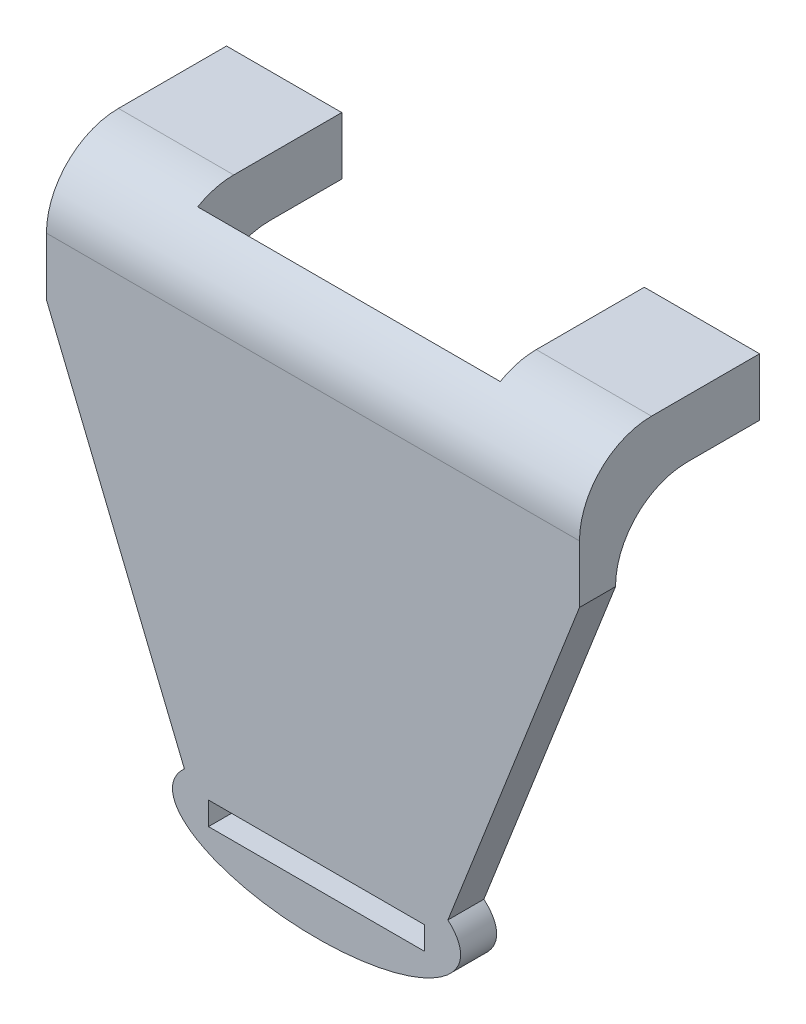
from build123d import *

# Parameters (mm, degrees)
PLATE_FEATURE_DEPTH        = 5
STRAP_FEATURE_SKETCH_RX    = 20
STRAP_FEATURE_SKETCH_RY    = 8
STRAP_FEATURE_DEPTH        = 5
STRAP_CUT_SKETCH_W         = 30
STRAP_CUT_SKETCH_H         = 3.19824666
STRAP_CUT_DEPTH            = 5
LEFT_LEG_FEATURE_SKETCH_W  = 16
LEFT_LEG_FEATURE_SKETCH_H  = 8
LEFT_LEG_FEATURE_DEPTH     = 20
RIGHT_LEG_FEATURE_SKETCH_W = 16
RIGHT_LEG_FEATURE_SKETCH_H = 8
RIGHT_LEG_FEATURE_DEPTH    = 20
TAB_CUT_SKETCH_W           = 8
TAB_CUT_SKETCH_H           = 15
TAB_CUT_DEPTH              = 5
FILLET1_R                  = 10
FILLET2_R                  = 10
FILLET3_R                  = 10


with BuildPart() as part:
    # Plate Feature Sketch → Plate Feature (new body)
    with BuildSketch(Plane.XY):
        Polygon((-36, 18), (-36, 0), (-15.55368079, -50), (18.44631921, -50), (38, 0), (38, 18), align=None)
    extrude(amount=PLATE_FEATURE_DEPTH)

    # Strap Feature Sketch → Strap Feature (add)
    with BuildSketch(Plane.XY):
        with Locations((1.5, -50)):
            Ellipse(STRAP_FEATURE_SKETCH_RX, STRAP_FEATURE_SKETCH_RY)
    extrude(amount=STRAP_FEATURE_DEPTH)

    # Strap Cut Sketch → Strap Cut (cut)
    with BuildSketch(Plane.XY):
        with Locations((1.5, -50.5)):
            Rectangle(STRAP_CUT_SKETCH_W, STRAP_CUT_SKETCH_H)
    extrude(amount=STRAP_CUT_DEPTH, mode=Mode.SUBTRACT)

    # Left Leg Feature Sketch → Left Leg Feature (add)
    with BuildSketch(Plane.XY):
        with Locations((30, 14)):
            Rectangle(LEFT_LEG_FEATURE_SKETCH_W, LEFT_LEG_FEATURE_SKETCH_H)
    extrude(amount=-LEFT_LEG_FEATURE_DEPTH)

    # Right Leg Feature Sketch → Right Leg Feature (add)
    with BuildSketch(Plane.XY):
        with Locations((-28, 14)):
            Rectangle(RIGHT_LEG_FEATURE_SKETCH_W, RIGHT_LEG_FEATURE_SKETCH_H)
    extrude(amount=-RIGHT_LEG_FEATURE_DEPTH)

    # Tab Cut Sketch → Tab Cut (cut)
    with BuildSketch(Plane(origin=(0, 10, 0), x_dir=(1, 0, 0), z_dir=(0, 1, 0))):
        with Locations((-28, 12.5)):
            Rectangle(TAB_CUT_SKETCH_W, TAB_CUT_SKETCH_H)
        with Locations((30, 12.5)):
            Rectangle(TAB_CUT_SKETCH_W, TAB_CUT_SKETCH_H)
    extrude(amount=TAB_CUT_DEPTH, mode=Mode.SUBTRACT)

    # Fillet1
    # the kernel refuses this fillet: 10 mm, written as the material it takes off along each edge
    with BuildSketch(Plane(origin=(63, 18, 5), x_dir=(0, 0, -1), z_dir=(-1, 0, 0))) as fillet1_piece_1:
        with BuildLine():
            CenterArc((FILLET1_R, FILLET1_R), FILLET1_R, 180, 90)
            Line((0, FILLET1_R), (0, 0))
            Line((0, 0), (FILLET1_R, 0))
        make_face()
    extrude(amount=124, mode=Mode.SUBTRACT)

    # Fillet2
    # the kernel refuses this fillet: 10 mm, written as the material it adds along each edge
    with BuildSketch(Plane(origin=(-36, 10, 0), x_dir=(0, 0, -1), z_dir=(1, 0, 0))) as fillet2_piece_1_section:
        with BuildLine():
            CenterArc((FILLET2_R, -FILLET2_R), FILLET2_R, 90, 90)
            Line((0, -FILLET2_R), (0, 0))
            Line((0, 0), (FILLET2_R, 0))
        make_face()
    fillet2_piece_1 = extrude(amount=16, mode=Mode.PRIVATE)
    fillet2_piece_1 = split(fillet2_piece_1, bisect_by=Plane(origin=(-34, 9.759916183, -5), z_dir=(0, 0, -1)), keep=Keep.TOP, mode=Mode.PRIVATE)
    fillet2_piece_1 = split(fillet2_piece_1, bisect_by=Plane(origin=(-32, 9.759916183, -6.632507845), z_dir=(-1, 0, 0)), keep=Keep.TOP, mode=Mode.PRIVATE)
    add(fillet2_piece_1)
    with BuildSketch(Plane(origin=(-36, 10, 0), x_dir=(0, 0, -1), z_dir=(1, 0, 0))) as fillet2_piece_2_section:
        with BuildLine():
            CenterArc((FILLET2_R, -FILLET2_R), FILLET2_R, 90, 90)
            Line((0, -FILLET2_R), (0, 0))
            Line((0, 0), (FILLET2_R, 0))
        make_face()
    fillet2_piece_2 = extrude(amount=16, mode=Mode.PRIVATE)
    fillet2_piece_2 = split(fillet2_piece_2, bisect_by=Plane(origin=(-34, 7.4487994, -5), z_dir=(0, 0, 1)), keep=Keep.TOP, mode=Mode.PRIVATE)
    fillet2_piece_2 = split(fillet2_piece_2, bisect_by=Plane(origin=(-32, 7.4487994, -1.643917643), z_dir=(-1, 0, 0)), keep=Keep.TOP, mode=Mode.PRIVATE)
    add(fillet2_piece_2)
    with BuildSketch(Plane(origin=(-36, 10, 0), x_dir=(0, 0, -1), z_dir=(1, 0, 0))) as fillet2_piece_3_section:
        with BuildLine():
            CenterArc((FILLET2_R, -FILLET2_R), FILLET2_R, 90, 90)
            Line((0, -FILLET2_R), (0, 0))
            Line((0, 0), (FILLET2_R, 0))
        make_face()
    fillet2_piece_3 = extrude(amount=16, mode=Mode.PRIVATE)
    fillet2_piece_3 = split(fillet2_piece_3, bisect_by=Plane(origin=(-24, 7.4487994, -1.643917643), z_dir=(-1, 0, 0)), keep=Keep.TOP, mode=Mode.PRIVATE)
    fillet2_piece_3 = split(fillet2_piece_3, bisect_by=Plane(origin=(-28, 7.4487994, -5), z_dir=(0, 0, 1)), keep=Keep.TOP, mode=Mode.PRIVATE)
    fillet2_piece_3 = split(fillet2_piece_3, bisect_by=Plane(origin=(-32, 7.4487994, -1.643917643), z_dir=(1, 0, 0)), keep=Keep.TOP, mode=Mode.PRIVATE)
    add(fillet2_piece_3)
    with BuildSketch(Plane(origin=(-36, 10, 0), x_dir=(0, 0, -1), z_dir=(1, 0, 0))) as fillet2_piece_4_section:
        with BuildLine():
            CenterArc((FILLET2_R, -FILLET2_R), FILLET2_R, 90, 90)
            Line((0, -FILLET2_R), (0, 0))
            Line((0, 0), (FILLET2_R, 0))
        make_face()
    fillet2_piece_4 = extrude(amount=16, mode=Mode.PRIVATE)
    fillet2_piece_4 = split(fillet2_piece_4, bisect_by=Plane(origin=(-24, 9.759916183, -6.632507845), z_dir=(1, 0, 0)), keep=Keep.TOP, mode=Mode.PRIVATE)
    fillet2_piece_4 = split(fillet2_piece_4, bisect_by=Plane(origin=(-22, 9.759916183, -5), z_dir=(0, 0, -1)), keep=Keep.TOP, mode=Mode.PRIVATE)
    add(fillet2_piece_4)
    with BuildSketch(Plane(origin=(-36, 10, 0), x_dir=(0, 0, -1), z_dir=(1, 0, 0))) as fillet2_piece_5_section:
        with BuildLine():
            CenterArc((FILLET2_R, -FILLET2_R), FILLET2_R, 90, 90)
            Line((0, -FILLET2_R), (0, 0))
            Line((0, 0), (FILLET2_R, 0))
        make_face()
    fillet2_piece_5 = extrude(amount=16, mode=Mode.PRIVATE)
    fillet2_piece_5 = split(fillet2_piece_5, bisect_by=Plane(origin=(-24, 7.4487994, -1.643917643), z_dir=(1, 0, 0)), keep=Keep.TOP, mode=Mode.PRIVATE)
    fillet2_piece_5 = split(fillet2_piece_5, bisect_by=Plane(origin=(-22, 7.4487994, -5), z_dir=(0, 0, 1)), keep=Keep.TOP, mode=Mode.PRIVATE)
    add(fillet2_piece_5)

    # Fillet3
    # the kernel refuses this fillet: 10 mm, written as the material it adds along each edge
    with BuildSketch(Plane(origin=(38, 10, 0), x_dir=(0, 0, -1), z_dir=(-1, 0, 0))) as fillet3_piece_1_section:
        with BuildLine():
            CenterArc((FILLET3_R, FILLET3_R), FILLET3_R, 180, 90)
            Line((0, FILLET3_R), (0, 0))
            Line((0, 0), (FILLET3_R, 0))
        make_face()
    fillet3_piece_1 = extrude(amount=16, mode=Mode.PRIVATE)
    fillet3_piece_1 = split(fillet3_piece_1, bisect_by=Plane(origin=(36, 9.759916183, -5), z_dir=(0, 0, -1)), keep=Keep.TOP, mode=Mode.PRIVATE)
    fillet3_piece_1 = split(fillet3_piece_1, bisect_by=Plane(origin=(34, 9.759916183, -6.632507845), z_dir=(1, 0, 0)), keep=Keep.TOP, mode=Mode.PRIVATE)
    add(fillet3_piece_1)
    with BuildSketch(Plane(origin=(38, 10, 0), x_dir=(0, 0, -1), z_dir=(-1, 0, 0))) as fillet3_piece_2_section:
        with BuildLine():
            CenterArc((FILLET3_R, FILLET3_R), FILLET3_R, 180, 90)
            Line((0, FILLET3_R), (0, 0))
            Line((0, 0), (FILLET3_R, 0))
        make_face()
    fillet3_piece_2 = extrude(amount=16, mode=Mode.PRIVATE)
    fillet3_piece_2 = split(fillet3_piece_2, bisect_by=Plane(origin=(36, 7.4487994, -5), z_dir=(0, 0, 1)), keep=Keep.TOP, mode=Mode.PRIVATE)
    fillet3_piece_2 = split(fillet3_piece_2, bisect_by=Plane(origin=(34, 7.4487994, -1.643917643), z_dir=(1, 0, 0)), keep=Keep.TOP, mode=Mode.PRIVATE)
    add(fillet3_piece_2)
    with BuildSketch(Plane(origin=(38, 10, 0), x_dir=(0, 0, -1), z_dir=(-1, 0, 0))) as fillet3_piece_3_section:
        with BuildLine():
            CenterArc((FILLET3_R, FILLET3_R), FILLET3_R, 180, 90)
            Line((0, FILLET3_R), (0, 0))
            Line((0, 0), (FILLET3_R, 0))
        make_face()
    fillet3_piece_3 = extrude(amount=16, mode=Mode.PRIVATE)
    fillet3_piece_3 = split(fillet3_piece_3, bisect_by=Plane(origin=(26, 7.4487994, -1.643917643), z_dir=(1, 0, 0)), keep=Keep.TOP, mode=Mode.PRIVATE)
    fillet3_piece_3 = split(fillet3_piece_3, bisect_by=Plane(origin=(30, 7.4487994, -5), z_dir=(0, 0, 1)), keep=Keep.TOP, mode=Mode.PRIVATE)
    fillet3_piece_3 = split(fillet3_piece_3, bisect_by=Plane(origin=(34, 7.4487994, -1.643917643), z_dir=(-1, 0, 0)), keep=Keep.TOP, mode=Mode.PRIVATE)
    add(fillet3_piece_3)
    with BuildSketch(Plane(origin=(38, 10, 0), x_dir=(0, 0, -1), z_dir=(-1, 0, 0))) as fillet3_piece_4_section:
        with BuildLine():
            CenterArc((FILLET3_R, FILLET3_R), FILLET3_R, 180, 90)
            Line((0, FILLET3_R), (0, 0))
            Line((0, 0), (FILLET3_R, 0))
        make_face()
    fillet3_piece_4 = extrude(amount=16, mode=Mode.PRIVATE)
    fillet3_piece_4 = split(fillet3_piece_4, bisect_by=Plane(origin=(26, 9.759916183, -6.632507845), z_dir=(-1, 0, 0)), keep=Keep.TOP, mode=Mode.PRIVATE)
    fillet3_piece_4 = split(fillet3_piece_4, bisect_by=Plane(origin=(24, 9.759916183, -5), z_dir=(0, 0, -1)), keep=Keep.TOP, mode=Mode.PRIVATE)
    add(fillet3_piece_4)
    with BuildSketch(Plane(origin=(38, 10, 0), x_dir=(0, 0, -1), z_dir=(-1, 0, 0))) as fillet3_piece_5_section:
        with BuildLine():
            CenterArc((FILLET3_R, FILLET3_R), FILLET3_R, 180, 90)
            Line((0, FILLET3_R), (0, 0))
            Line((0, 0), (FILLET3_R, 0))
        make_face()
    fillet3_piece_5 = extrude(amount=16, mode=Mode.PRIVATE)
    fillet3_piece_5 = split(fillet3_piece_5, bisect_by=Plane(origin=(26, 7.4487994, -1.643917643), z_dir=(-1, 0, 0)), keep=Keep.TOP, mode=Mode.PRIVATE)
    fillet3_piece_5 = split(fillet3_piece_5, bisect_by=Plane(origin=(24, 7.4487994, -5), z_dir=(0, 0, 1)), keep=Keep.TOP, mode=Mode.PRIVATE)
    add(fillet3_piece_5)


solid = part.part
